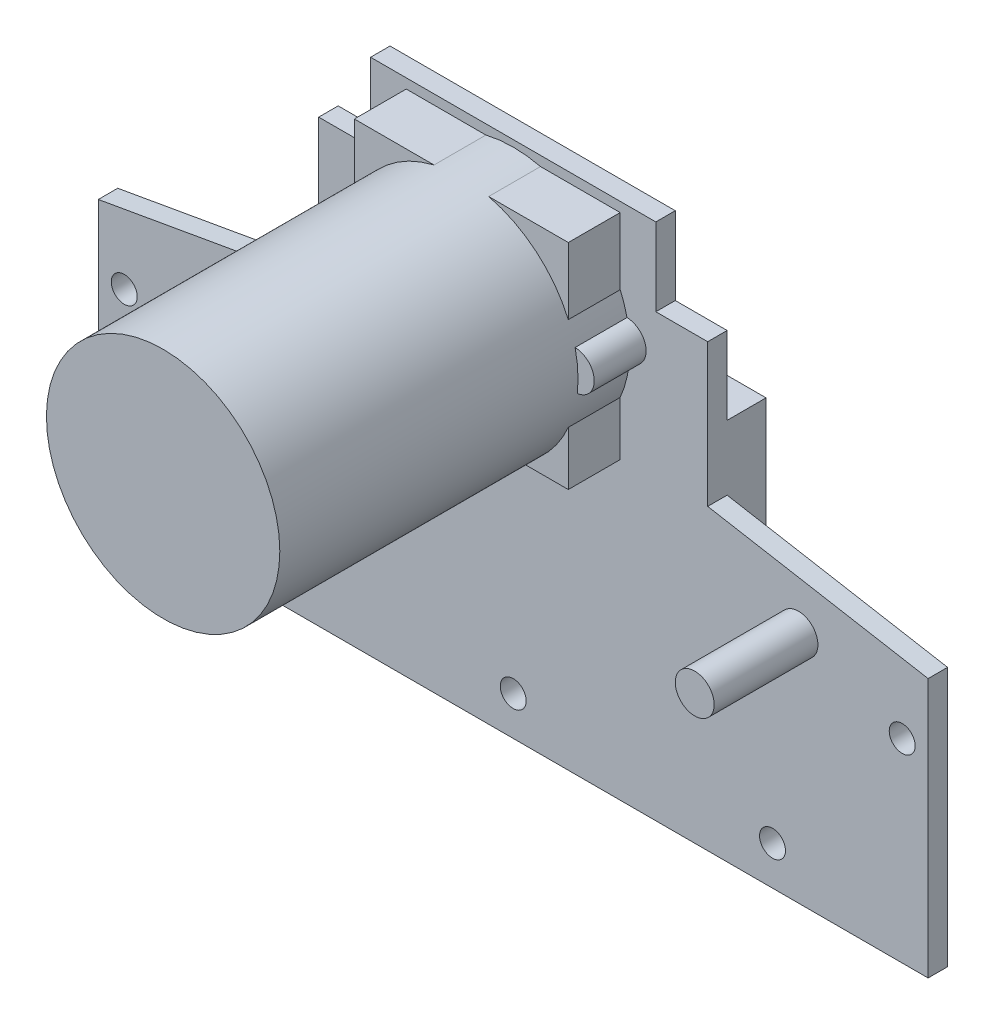
from build123d import *

# Parameters (mm, degrees)
BOSS_EXTRUDE1_DEPTH = 1.5
SKETCH2_R           = 1
CUT_EXTRUDE1_DEPTH  = 5
SKETCH3_R           = 9
BOSS_EXTRUDE2_DEPTH = 27
SKETCH5_W           = 28
SKETCH5_H           = 21
BOSS_EXTRUDE3_DEPTH = 3
SKETCH6_R           = 1.5
BOSS_EXTRUDE4_DEPTH = 8
SKETCH7_R           = 1.5
SKETCH7_W           = 16.5
SKETCH7_H           = 16.5
BOSS_EXTRUDE5_DEPTH = 4


with BuildPart() as part:
    # Sketch1 → Boss-Extrude1 (new body)
    with BuildSketch(Plane.XY):
        Polygon((-32, 20), (-32, 0), (32, 0), (32, 20), (15, 23), (15, 34), (11, 34), (11, 40), (-11, 40), (-11, 34), (-15, 34), (-15, 23), align=None)
    extrude(amount=BOSS_EXTRUDE1_DEPTH)

    # Sketch2 → Cut-Extrude1 (cut)
    with BuildSketch(Plane.XY.offset(1.5)):
        with Locations((20, 3)):
            Circle(SKETCH2_R)
        with Locations((0, 3)):
            Circle(SKETCH2_R)
        with Locations((-20, 3)):
            Circle(SKETCH2_R)
        with Locations((-30, 15)):
            Circle(SKETCH2_R)
        with Locations((30, 15)):
            Circle(SKETCH2_R)
    extrude(amount=-CUT_EXTRUDE1_DEPTH, mode=Mode.SUBTRACT)

    # Sketch3 → Boss-Extrude2 (add)
    with BuildSketch(Plane.XY.offset(1.5)):
        with Locations((0, 30.5)):
            Circle(SKETCH3_R)
    extrude(amount=BOSS_EXTRUDE2_DEPTH)

    # Sketch5 → Boss-Extrude3 (add)
    with BuildSketch(Plane(origin=(0, 0, 0), x_dir=(-1, 0, 0), z_dir=(0, 0, -1))):
        with Locations((-1, 17.5)):
            Rectangle(SKETCH5_W, SKETCH5_H)
    extrude(amount=BOSS_EXTRUDE3_DEPTH)

    # Sketch6 → Boss-Extrude4 (add)
    with BuildSketch(Plane.XY.offset(1.5)):
        with Locations((22, 18)):
            Circle(SKETCH6_R)
        with Locations((-22, 18)):
            Circle(SKETCH6_R)
    extrude(amount=BOSS_EXTRUDE4_DEPTH)

    # Sketch7 → Boss-Extrude5 (add)
    with BuildSketch(Plane.XY.offset(1.5)):
        with Locations((-8.75, 31)):
            Circle(SKETCH7_R)
        with Locations((8.75, 31)):
            Circle(SKETCH7_R)
        with Locations((0, 31)):
            Rectangle(SKETCH7_W, SKETCH7_H)
    extrude(amount=BOSS_EXTRUDE5_DEPTH)


solid = part.part
